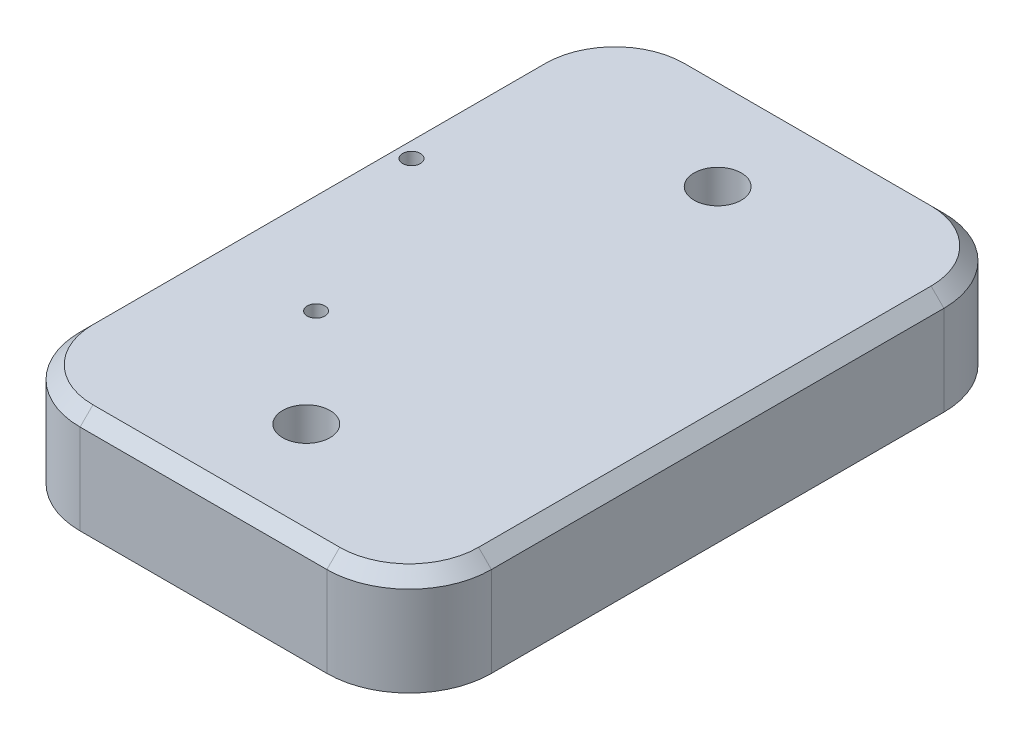
from build123d import *

# Parameters (mm, degrees)
SKETCH1_W           = 76.2
SKETCH1_H           = 12.7
BOSS_EXTRUDE1_DEPTH = 50.8
SKETCH3_R           = 1.0922
SKETCH3_R_2         = 2.921
CUT_EXTRUDE2_DEPTH  = 93.457395594
FILLET1_R           = 10.16
CHAMFER1_SIZE       = 1.5875


with BuildPart() as part:
    # Sketch1 → Boss-Extrude1 (new body)
    with BuildSketch(Plane(origin=(0, 0, 0), x_dir=(0, 0, -1), z_dir=(1, 0, 0))):
        with Locations((38.1, 6.35)):
            Rectangle(SKETCH1_W, SKETCH1_H)
    extrude(amount=BOSS_EXTRUDE1_DEPTH)

    # Sketch3 → Cut-Extrude2 (cut, through all)
    with BuildSketch(Plane.XZ):
        with Locations((13.9065, -25.4)):
            Circle(SKETCH3_R)
        with Locations((3.4925, -47.5996)):
            Circle(SKETCH3_R)
        with Locations((25.4, -63.5)):
            Circle(SKETCH3_R_2)
        with Locations((25.4, -12.7)):
            Circle(SKETCH3_R_2)
    extrude(amount=-CUT_EXTRUDE2_DEPTH, mode=Mode.SUBTRACT)

    # Fillet1
    fillet1_edges = [part.edges().sort_by_distance(p)[0] for p in [
        (0, 6.35, 0),
        (50.8, 6.35, 0),
        (0, 6.35, -76.2),
        (50.8, 6.35, -76.2),
    ]]
    fillet(fillet1_edges, radius=FILLET1_R)

    # Chamfer1
    chamfer1_edges = [part.edges().sort_by_distance(p)[0] for p in [
        (0, 12.7, -38.1),
        (2.975795103, 12.7, -2.975795103),
        (25.4, 12.7, 0),
        (47.824204897, 12.7, -2.975795103),
        (50.8, 12.7, -38.1),
        (47.824204897, 12.7, -73.224204897),
        (25.4, 12.7, -76.2),
        (2.975795103, 12.7, -73.224204897),
    ]]
    chamfer(chamfer1_edges, length=CHAMFER1_SIZE)


solid = part.part
